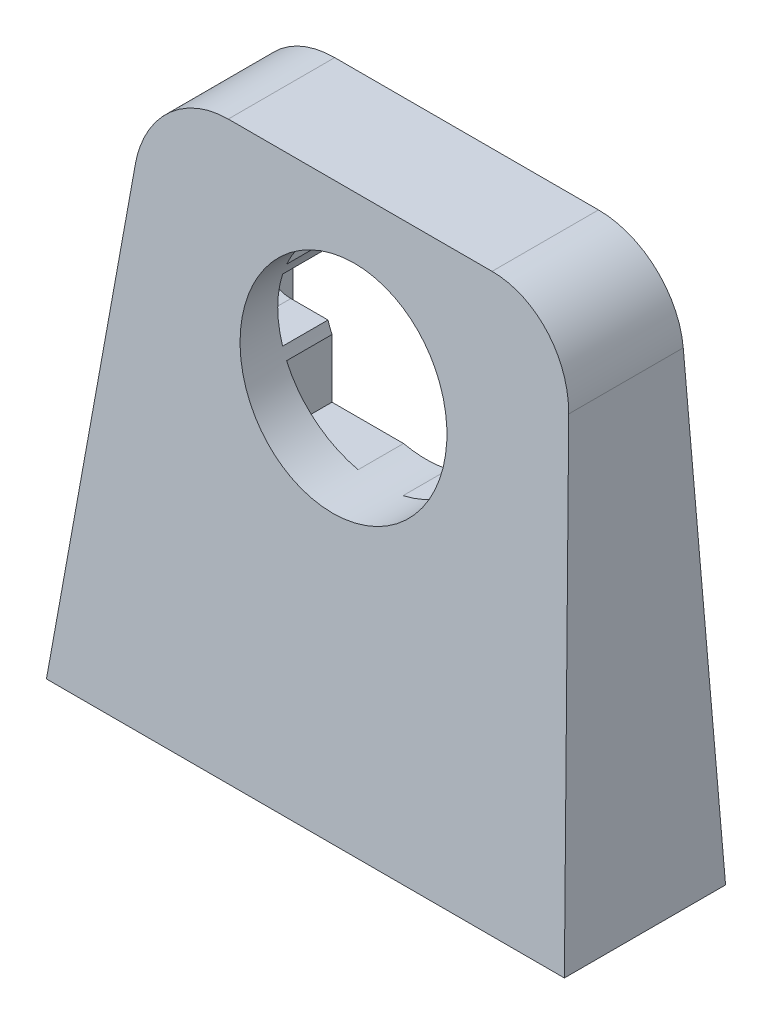
from build123d import *

# Parameters (mm, degrees)
SKETCH1_W               = 24.5
SKETCH1_H               = 34.22
BOSS_EXTRUDE1_DEPTH     = 7.5
SKETCH2_W               = 24.5
SKETCH2_H               = 34.22
CUT_EXTRUDE1_DEPTH      = 2.86
SKETCH3_W               = 13.25
SKETCH3_H               = 14.15
CUT_EXTRUDE2_DEPTH      = 3.2
BOSS_EXTRUDE2_START     = -18.25
BOSS_EXTRUDE2_DEPTH     = 36.5
BOSS_EXTRUDE2_START_2   = 7.5
BOSS_EXTRUDE2_2_DEPTH   = 4.5
CUT_EXTRUDE3_DEPTH      = 28.465218004
CUT_EXTRUDE3_DEPTH_BACK = 28.465218004
SKETCH4_R               = 7.25
FILLET1_R               = 6
SKETCH6_R               = 1.475
CUT_EXTRUDE4_DEPTH      = 3


with BuildPart() as part:
    # Sketch1 → Boss-Extrude1 (new body)
    with BuildSketch(Plane.XY):
        Polygon((-12.25, -17.11), (-12.25, 17.11), (12.25, 17.11), (12.25, -17.11), (18.25, -17.11), (14.75, 19.61), (-14.75, 19.61), (-18.25, -17.11), align=None)
        Rectangle(SKETCH1_W, SKETCH1_H)
    extrude(amount=BOSS_EXTRUDE1_DEPTH)

    # Sketch2 → Cut-Extrude1 (cut)
    with BuildSketch(Plane(origin=(0, 0, 0), x_dir=(-1, 0, 0), z_dir=(0, 0, -1))):
        Rectangle(SKETCH2_W, SKETCH2_H)
    extrude(amount=-CUT_EXTRUDE1_DEPTH, mode=Mode.SUBTRACT)

    # Sketch3 → Cut-Extrude2 (cut)
    with BuildSketch(Plane(origin=(0, 0, 2.86), x_dir=(-1, 0, 0), z_dir=(0, 0, -1))):
        with BuildLine():
            Line((-6.625, 6.22), (-6.625, 10.62))
            Line((-6.625, 10.62), (-9.525, 10.62))
            ThreePointArc((-9.525, 10.62), (-11.725, 8.42), (-9.525, 6.22))
            Line((-9.525, 6.22), (-6.625, 6.22))
        make_face()
        with Locations((0, 8.42)):
            Rectangle(SKETCH3_W, SKETCH3_H)
        with BuildLine():
            Line((9.525, 10.62), (6.625, 10.62))
            Line((6.625, 10.62), (6.625, 6.22))
            Line((6.625, 6.22), (9.525, 6.22))
            ThreePointArc((9.525, 6.22), (11.725, 8.42), (9.525, 10.62))
        make_face()
    extrude(amount=-CUT_EXTRUDE2_DEPTH, mode=Mode.SUBTRACT)

    # Boss-Extrude2: read off the stored shape, not the designer's step
    # Boss-Extrude2 outline → Boss-Extrude2 (add)
    with BuildSketch(Plane.YZ.offset(BOSS_EXTRUDE2_START)):
        Polygon((-17.11, 11.359427519), (-17.11, 7.5), (19.61, 7.5), align=None)
    extrude(amount=BOSS_EXTRUDE2_DEPTH)

    # Boss-Extrude2 2 outline → Boss-Extrude2 2 (cut)
    with BuildSketch(Plane.XY.offset(BOSS_EXTRUDE2_START_2)):
        Polygon((14.75, 19.61), (18.25, -17.11), (18.25, 21), (14.617510893, 21), align=None)
        Polygon((-14.75, 19.61), (-14.617510893, 21), (-18.25, 21), (-18.25, -17.11), align=None)
    extrude(amount=BOSS_EXTRUDE2_2_DEPTH, mode=Mode.SUBTRACT)

    # Sketch4 → Cut-Extrude3 (cut, two sides: drawn at the far end of the back side and taken through both)
    with BuildSketch(Plane(origin=(0, 0, 6.06), x_dir=(-1, 0, 0), z_dir=(0, 0, -1)).offset(-CUT_EXTRUDE3_DEPTH_BACK)):
        with Locations(Location((0, 8.42, 0), (0, 0, 17.6648328))):
            Circle(SKETCH4_R)
    extrude(amount=CUT_EXTRUDE3_DEPTH + CUT_EXTRUDE3_DEPTH_BACK, mode=Mode.SUBTRACT)

    # Fillet1
    fillet1_edges = [part.edges().sort_by_distance(p)[0] for p in [
        (-14.75, 19.61, 3.75),
        (14.75, 19.61, 3.75),
    ]]
    fillet(fillet1_edges, radius=FILLET1_R)

    # Sketch6 → Cut-Extrude4 (cut)
    with BuildSketch(Plane(origin=(0, 0, 2.86), x_dir=(-1, 0, 0), z_dir=(0, 0, -1))):
        with Locations((-10.2, 14.86)):
            Circle(SKETCH6_R)
        with Locations(Location((10.2, 14.86, 0), (0, 0, 180))):
            Circle(SKETCH6_R)
    extrude(amount=-CUT_EXTRUDE4_DEPTH, mode=Mode.SUBTRACT)


solid = part.part
